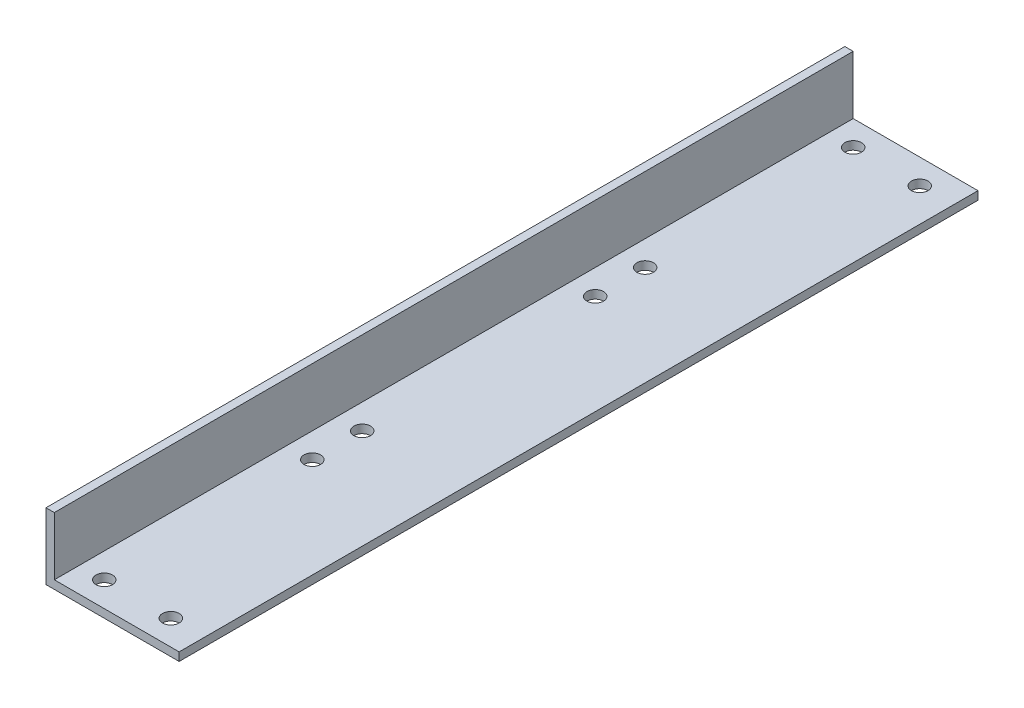
from build123d import *

# Parameters (mm, degrees)
BOSS_EXTRUDE1_DEPTH = 304.8
SKETCH2_R           = 3.175
CUT_EXTRUDE1_DEPTH  = 311.04651264


with BuildPart() as part:
    # Sketch1 → Boss-Extrude1 (new body)
    with BuildSketch(Plane.XY):
        Polygon((0, 0), (50.8, 0), (50.8, 3.175), (3.175, 3.175), (3.175, 25.4), (0, 25.4), align=None)
    extrude(amount=BOSS_EXTRUDE1_DEPTH)

    # Sketch2 → Cut-Extrude1 (cut, through all)
    with BuildSketch(Plane.XZ):
        with Locations((38.1, 9.525)):
            Circle(SKETCH2_R)
        with Locations((12.7, 9.525)):
            Circle(SKETCH2_R)
        with Locations((12.7, 107.95)):
            Circle(SKETCH2_R)
        with Locations((12.7, 88.9)):
            Circle(SKETCH2_R)
        with Locations((38.1, 295.275)):
            Circle(SKETCH2_R)
        with Locations((12.7, 295.275)):
            Circle(SKETCH2_R)
        with Locations((12.7, 196.85)):
            Circle(SKETCH2_R)
        with Locations((12.7, 215.9)):
            Circle(SKETCH2_R)
    extrude(amount=-CUT_EXTRUDE1_DEPTH, mode=Mode.SUBTRACT)


solid = part.part
